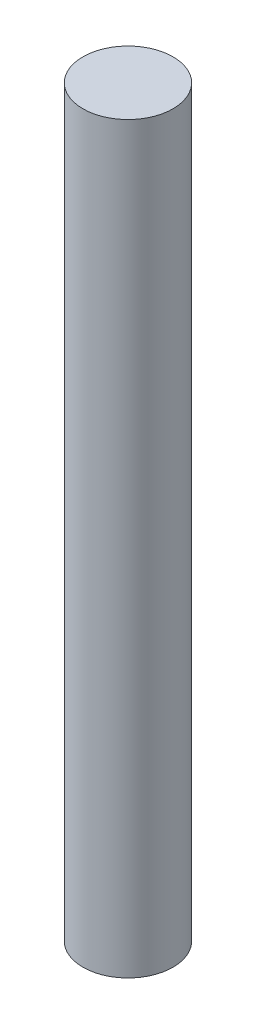
from build123d import *

# Parameters (mm, degrees)
SKETCH1_R           = 2
BOSS_EXTRUDE1_DEPTH = 33


with BuildPart() as part:
    # Sketch1 → Boss-Extrude1 (new body)
    with BuildSketch(Plane(origin=(0, 0, 0), x_dir=(1, 0, 0), z_dir=(0, 1, 0))):
        Circle(SKETCH1_R)
    extrude(amount=BOSS_EXTRUDE1_DEPTH)


solid = part.part
